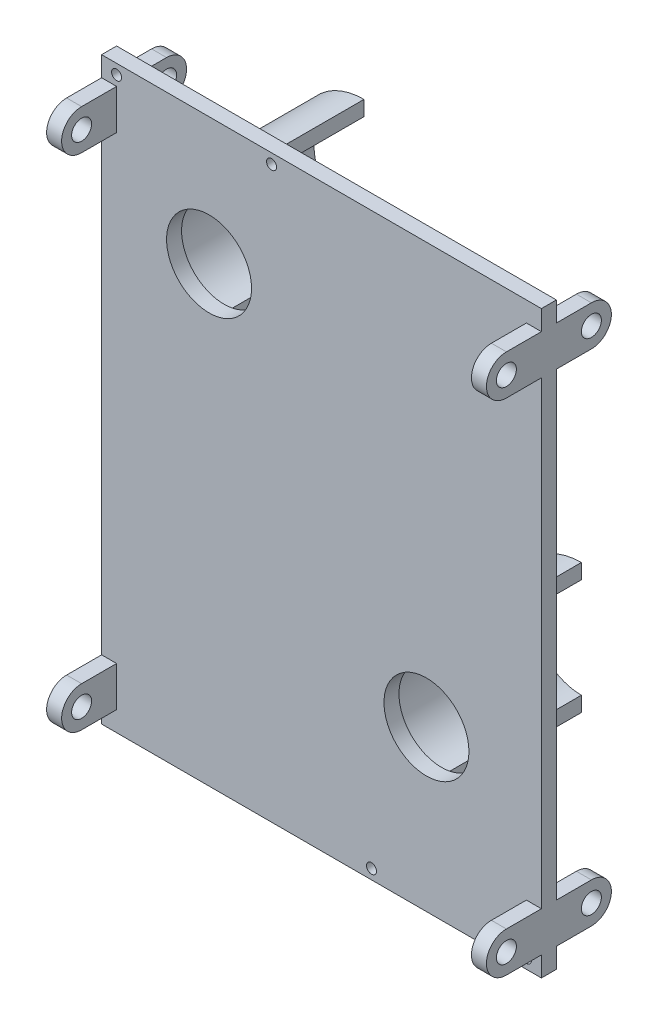
from build123d import *

# Parameters (mm, degrees)
SKETCH1_W           = 88
SKETCH1_H           = 116
BOSS_EXTRUDE1_DEPTH = 3
SKETCH2_R           = 8.5
CUT_EXTRUDE1_DEPTH  = 73.862884928
SKETCH4_R           = 2
BOSS_EXTRUDE3_DEPTH = 3
SKETCH6_R           = 1
CUT_EXTRUDE2_DEPTH  = 10
BOSS_EXTRUDE4_DEPTH = 28


with BuildPart() as part:
    # Sketch1 → Boss-Extrude1 (new body)
    with BuildSketch(Plane.XY):
        Rectangle(SKETCH1_W, SKETCH1_H)
    extrude(amount=BOSS_EXTRUDE1_DEPTH)

    # Sketch2 → Cut-Extrude1 (cut, through all)
    with BuildSketch(Plane.XY.offset(3)):
        with Locations((-22.5, 32.5)):
            Circle(SKETCH2_R)
        with Locations((21, -26)):
            Circle(SKETCH2_R)
    extrude(amount=-CUT_EXTRUDE1_DEPTH, mode=Mode.SUBTRACT)

    # Sketch4 → Boss-Extrude3 (add)
    # profile 1 of 4: a face of its own
    with BuildSketch(Plane.ZY.offset(44)):
        with BuildLine():
            Line((-7, 54), (0, 54))
            Line((0, 54), (0, 46))
            Line((0, 46), (-7, 46))
            ThreePointArc((-7, 46), (-11, 50), (-7, 54))
        make_face()
        with Locations((-7, 50)):
            Circle(SKETCH4_R, mode=Mode.SUBTRACT)
    # profile 2 of 4: a face of its own
    with BuildSketch(Plane.ZY.offset(44)):
        with BuildLine():
            Line((0, -46), (-7, -46))
            ThreePointArc((-7, -46), (-11, -50), (-7, -54))
            Line((-7, -54), (0, -54))
            Line((0, -54), (0, -46))
        make_face()
        with Locations((-7, -50)):
            Circle(SKETCH4_R, mode=Mode.SUBTRACT)
    # profile 3 of 4: a face of its own
    with BuildSketch(Plane.ZY.offset(44)):
        with BuildLine():
            Line((3, 46), (10, 46))
            ThreePointArc((10, 46), (14, 50), (10, 54))
            Line((10, 54), (3, 54))
            Line((3, 54), (3, 46))
        make_face()
        with Locations((10, 50)):
            Circle(SKETCH4_R, mode=Mode.SUBTRACT)
    # profile 4 of 4: a face of its own
    with BuildSketch(Plane.ZY.offset(44)):
        with BuildLine():
            Line((10, -54), (3, -54))
            Line((3, -54), (3, -46))
            Line((3, -46), (10, -46))
            ThreePointArc((10, -46), (14, -50), (10, -54))
        make_face()
        with Locations((10, -50)):
            Circle(SKETCH4_R, mode=Mode.SUBTRACT)
    boss_extrude3 = extrude(amount=-BOSS_EXTRUDE3_DEPTH)

    # Sketch6 → Cut-Extrude2 (cut)
    with BuildSketch(Plane.XY.offset(3)):
        with Locations((-41, 56)):
            Circle(SKETCH6_R)
        with Locations((-10, 56)):
            Circle(SKETCH6_R)
        with Locations((41, -56)):
            Circle(SKETCH6_R)
        with Locations((10, -56)):
            Circle(SKETCH6_R)
    extrude(amount=-CUT_EXTRUDE2_DEPTH, mode=Mode.SUBTRACT)

    # Sketch5 → Boss-Extrude4 (add)
    with BuildSketch(Plane(origin=(0, 0, 0), x_dir=(-1, 0, 0), z_dir=(0, 0, -1))):
        with BuildLine():
            Line((22.5, 45.5), (22.5, 42.5))
            ThreePointArc((22.5, 42.5), (32.5, 32.5), (22.5, 22.5))
            Line((22.5, 22.5), (22.5, 19.5))
            ThreePointArc((22.5, 19.5), (35.5, 32.5), (22.5, 45.5))
        make_face()
        with BuildLine():
            Line((-21, -13), (-21, -16))
            ThreePointArc((-21, -16), (-11, -26), (-21, -36))
            Line((-21, -36), (-21, -39))
            ThreePointArc((-21, -39), (-8, -26), (-21, -13))
        make_face()
    extrude(amount=BOSS_EXTRUDE4_DEPTH)

    # Mirror1: Boss-Extrude3 across plane
    add(boss_extrude3.mirror(Plane(origin=(0, 0, 0), x_dir=(0, 0, 1), z_dir=(1, 0, 0))))


solid = part.part
